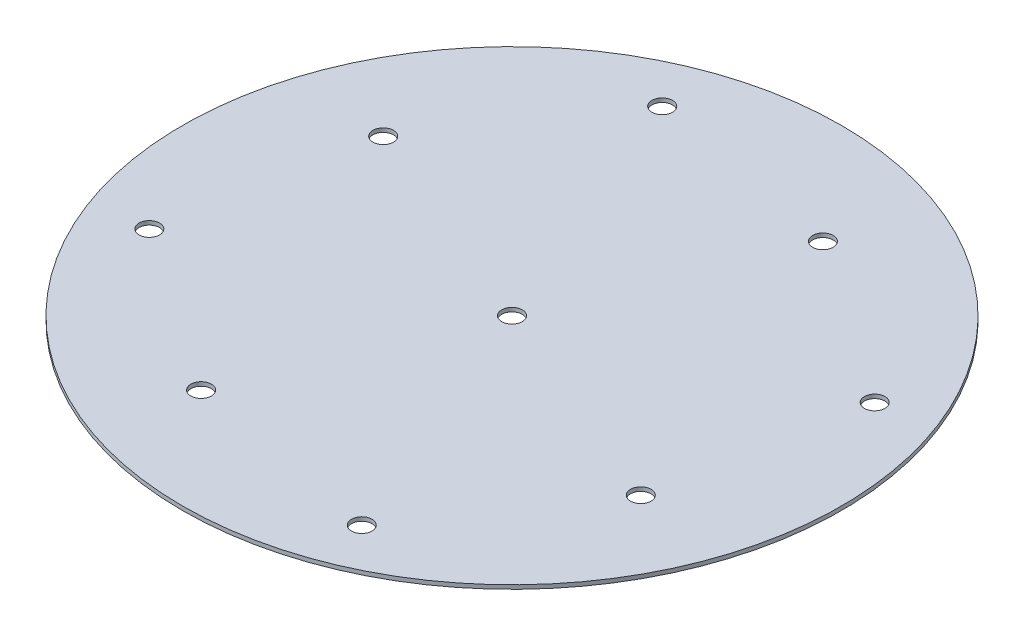
from build123d import *

# Parameters (mm, degrees)
SKETCH2_W                  = 83.09991
SKETCH2_H                  = 1
F_6_0_204_DIAMETER_HOLE1_D = 5.1816
CIRPATTERN3_COUNT          = 4
F_6_0_204_DIAMETER_HOLE2_D = 5.1816


with BuildPart() as part:
    # Sketch2 → Revolve1 (revolve)
    with BuildSketch(Plane(origin=(0, 0, 0), x_dir=(0, 0, -1), z_dir=(1, 0, 0))):
        with Locations((-41.549955, 0.5)):
            Rectangle(SKETCH2_W, SKETCH2_H)
    revolve(axis=Axis((0, -0.05, 0), (0, 1, 0)))

    # #6 (0.204) Diameter Hole1 (through all)
    with Locations(Plane(origin=(0, 1, 0), x_dir=(1, 0, 0), z_dir=(0, 1, 0))):
        with Locations((-26.787840266, 64.671567276), (264.743675233, 73.787758551), (-55.432771951, 22.961005942)):
            f_6_0_204_diameter_hole1 = Hole(F_6_0_204_DIAMETER_HOLE1_D / 2)

    # CirPattern3: #6 (0.204) Diameter Hole1 ×4 about axis
    cirpattern3_axis = Axis((0, -0.05, 0), (0, 1, 0))
    for i in range(1, CIRPATTERN3_COUNT):
        add(f_6_0_204_diameter_hole1.rotate(cirpattern3_axis, i * 360 / CIRPATTERN3_COUNT), mode=Mode.SUBTRACT)

    # #6 (0.204) Diameter Hole2 (through all)
    with Locations(Plane(origin=(0, 1, 0), x_dir=(1, 0, 0), z_dir=(0, 1, 0))):
        with Locations((0, 0)):
            Hole(F_6_0_204_DIAMETER_HOLE2_D / 2)


solid = part.part
